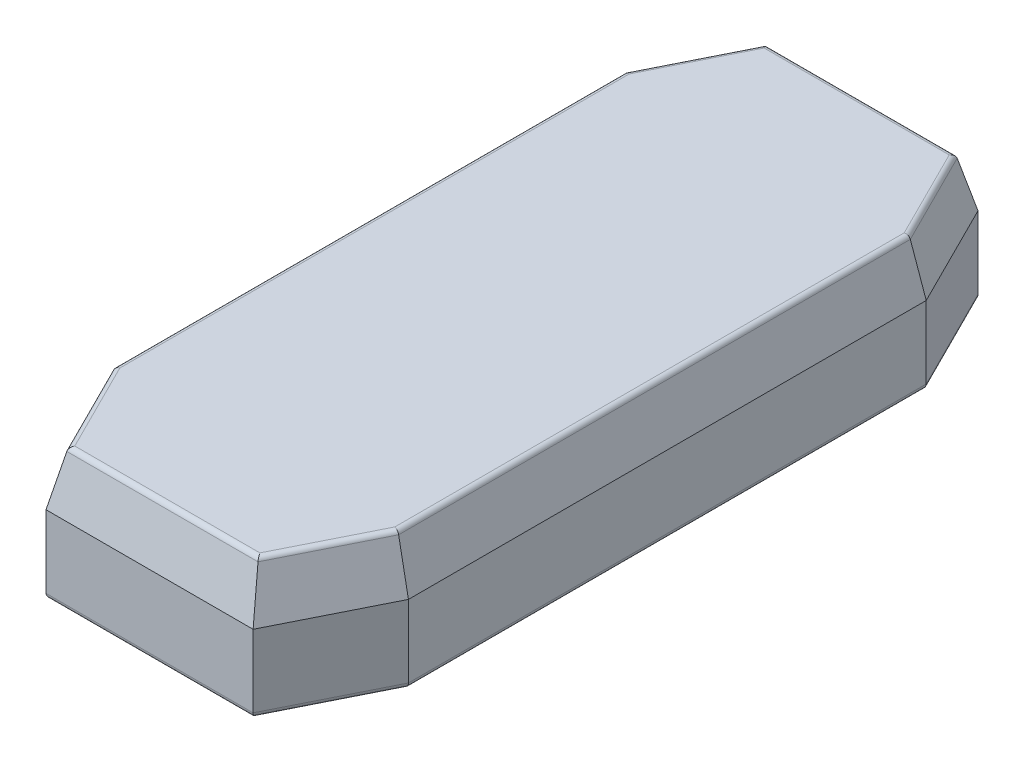
from build123d import *

# Parameters (mm, degrees)
BOSS_EXTRUDE1_DEPTH = 2.54
BOSS_EXTRUDE1_TAPER = 15
BOSS_EXTRUDE2_DEPTH = 3.8
FILLET2_R           = 0.1
CHAMFER1_SIZE       = 0.2
BOSS_EXTRUDE3_DEPTH = 3.8
FILLET3_R           = 0.25
FILLET5_R           = 0.5
FILLET6_R           = 0.1
FILLET7_R           = 0.25


with BuildPart() as part:
    # Sketch1 → Boss-Extrude1 (new body)
    with BuildSketch(Plane(origin=(0, 0, 0), x_dir=(1, 0, 0), z_dir=(0, 1, 0))):
        Polygon((-7.62, 12.7), (-7.62, -12.7), (-5.08, -17.78), (5.08, -17.78), (7.62, -12.7), (7.62, 12.7), (5.08, 17.78), (-5.08, 17.78), align=None)
    extrude(amount=BOSS_EXTRUDE1_DEPTH, taper=BOSS_EXTRUDE1_TAPER)

    # Stem → Boss-Extrude2 (add)
    with BuildSketch(Plane.XZ):
        with BuildLine():
            Line((2.499999969, 2.5), (-2.499999969, 2.5))
            ThreePointArc((-2.499999969, 2.5), (-2.85355336, 2.353553391), (-2.999999969, 2))
            Line((-2.999999969, 2), (-2.999999969, -2))
            ThreePointArc((-2.999999969, -2), (-2.85355336, -2.353553391), (-2.499999969, -2.5))
            Line((-2.499999969, -2.5), (2.499999969, -2.5))
            ThreePointArc((2.499999969, -2.5), (2.85355336, -2.353553391), (2.999999969, -2))
            Line((2.999999969, -2), (2.999999969, 2))
            ThreePointArc((2.999999969, 2), (2.85355336, 2.353553391), (2.499999969, 2.5))
        make_face()
        Polygon((-0.5625, 0.6625), (-0.5625, 2.075), (0.5625, 2.075), (0.5625, 0.6625), (2.0625, 0.6625), (2.0625, -0.6625), (0.5625, -0.6625), (0.5625, -2.075), (-0.5625, -2.075), (-0.5625, -0.6625), (-2.0625, -0.6625), (-2.0625, 0.6625), align=None, mode=Mode.SUBTRACT)
    extrude(amount=BOSS_EXTRUDE2_DEPTH)

    # Fillet2
    fillet2_edges = [part.edges().sort_by_distance(p)[0] for p in [
        (-2.85355336, -3.8, -2.353553391),
        (-2.999999969, -3.8, 0),
        (-2.85355336, -3.8, 2.353553391),
        (0, -3.8, 2.5),
        (2.85355336, -3.8, 2.353553391),
        (2.999999969, -3.8, 0),
        (2.85355336, -3.8, -2.353553391),
        (0, -3.8, -2.5),
    ]]
    fillet(fillet2_edges, radius=FILLET2_R)

    # Chamfer1
    chamfer1_edges = [part.edges().sort_by_distance(p)[0] for p in [
        (-0.5625, -3.8, -1.36875),
        (-1.3125, -3.8, -0.6625),
        (-2.0625, -3.8, 0),
        (0.5625, -3.8, -1.36875),
        (1.3125, -3.8, -0.6625),
        (2.0625, -3.8, 0),
        (1.3125, -3.8, 0.6625),
        (0.5625, -3.8, 1.36875),
        (0, -3.8, 2.075),
        (-0.5625, -3.8, 1.36875),
        (-1.3125, -3.8, 0.6625),
    ]]
    chamfer(chamfer1_edges, length=CHAMFER1_SIZE)

    # Sketch3 → Boss-Extrude3 (add)
    with BuildSketch(Plane.XZ):
        Polygon((-7.62, 12.7), (-7.62, -12.7), (-5.08, -17.78), (5.08, -17.78), (7.62, -12.7), (7.62, 12.7), (5.08, 17.78), (-5.08, 17.78), align=None)
        Polygon((-6.35, -12.400193669), (-4.295096834, -16.51), (4.295096834, -16.51), (6.35, -12.400193669), (6.35, 12.400193669), (4.295096834, 16.51), (-4.295096834, 16.51), (-6.35, 12.400193669), align=None, mode=Mode.SUBTRACT)
    extrude(amount=BOSS_EXTRUDE3_DEPTH)

    # Fillet3
    fillet3_edges = [part.edges().sort_by_distance(p)[0] for p in [
        (0, -3.8, -16.51),
        (5.322548417, -3.8, -14.455096834),
        (6.35, -3.8, 0),
        (5.322548417, -3.8, 14.455096834),
        (0, -3.8, 16.51),
        (-5.322548417, -3.8, 14.455096834),
        (-6.35, -3.8, 0),
        (-5.322548417, -3.8, -14.455096834),
        (0, -3.8, 17.78),
        (6.35, -3.8, 15.24),
        (7.62, -3.8, 0),
        (6.35, -3.8, -15.24),
        (0, -3.8, -17.78),
        (-6.35, -3.8, -15.24),
        (-7.62, -3.8, 0),
        (-6.35, -3.8, 15.24),
    ]]
    fillet(fillet3_edges, radius=FILLET3_R)

    # Fillet5
    fillet5_edges = [part.edges().sort_by_distance(p)[0] for p in [
        (0, 0, 2.5),
        (-2.85355336, 0, 2.353553391),
        (-2.999999969, 0, 0),
        (-2.85355336, 0, -2.353553391),
        (0, 0, -2.5),
        (2.85355336, 0, -2.353553391),
        (2.999999969, 0, 0),
        (2.85355336, 0, 2.353553391),
        (-5.322548417, 0, 14.455096834),
        (0, 0, 16.51),
        (5.322548417, 0, 14.455096834),
        (6.35, 0, 0),
        (5.322548417, 0, -14.455096834),
        (0, 0, -16.51),
        (-5.322548417, 0, -14.455096834),
        (-6.35, 0, 0),
    ]]
    fillet(fillet5_edges, radius=FILLET5_R)

    # Fillet6
    fillet6_edges = [part.edges().sort_by_distance(p)[0] for p in [
        (-1.3125, 0, 0.6625),
        (-0.5625, 0, 1.36875),
        (0, 0, 2.075),
        (0.5625, 0, 1.36875),
        (1.3125, 0, 0.6625),
        (2.0625, 0, 0),
        (1.3125, 0, -0.6625),
        (0.5625, 0, -1.36875),
        (0, 0, -2.075),
        (-0.5625, 0, -1.36875),
        (-1.3125, 0, -0.6625),
        (-2.0625, 0, 0),
    ]]
    fillet(fillet6_edges, radius=FILLET6_R)

    # Fillet7
    fillet7_edges = [part.edges().sort_by_distance(p)[0] for p in [
        (5.799390356, 2.54, -14.819371661),
        (6.939409051, 2.54, 0),
        (5.799390356, 2.54, 14.819371661),
        (0, 2.54, 17.099409051),
        (-5.799390356, 2.54, 14.819371661),
        (-6.939409051, 2.54, 0),
        (-5.799390356, 2.54, -14.819371661),
        (0, 2.54, -17.099409051),
    ]]
    fillet(fillet7_edges, radius=FILLET7_R)


solid = part.part
